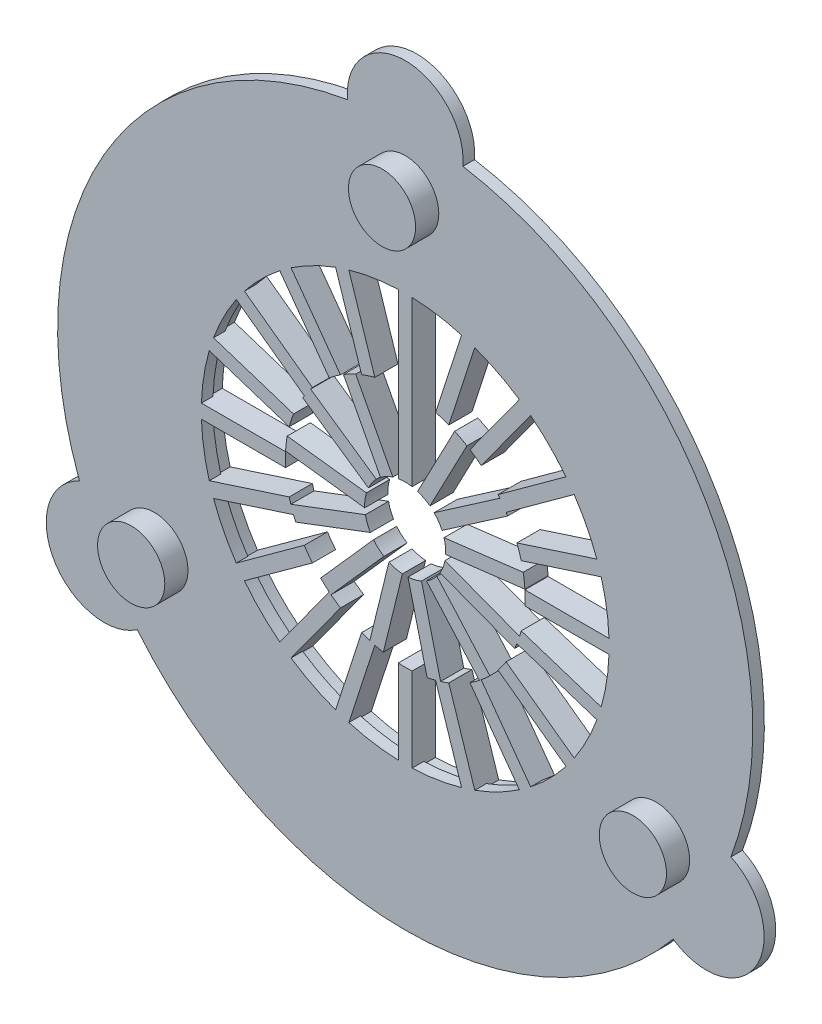
from build123d import *

# Parameters (mm, degrees)
SKETCH2_R           = 18.85
SKETCH2_R_2         = 17.804043165
BOSS_EXTRUDE1_DEPTH = 2
SKETCH3_R           = 30
SKETCH3_R_2         = 17.600030795
BOSS_EXTRUDE2_DEPTH = 1
SKETCH4_R           = 2.9
BOSS_EXTRUDE3_DEPTH = 2
SKETCH6_R           = 5
BOSS_EXTRUDE4_DEPTH = 1


with BuildPart() as part:
    # Sketch2 → Boss-Extrude1 (new body)
    # profile 1 of 34: a face of its own
    with BuildSketch(Plane.XY.offset(10)):
        Circle(SKETCH2_R)
        Circle(SKETCH2_R_2, mode=Mode.SUBTRACT)
    # profile 2 of 34: a face of its own
    with BuildSketch(Plane.XY.offset(10)):
        with BuildLine():
            ThreePointArc((14.748263104, 9.973599573), (14.403773489, 10.464954003), (14.042920801, 10.944419966))
            Line((14.042920801, 10.944419966), (8.004799589, 6.557468116))
            ThreePointArc((8.004799589, 6.557468116), (8.083447524, 6.460269397), (8.160915289, 6.36212749))
            ThreePointArc((8.160915289, 6.36212749), (8.444435139, 5.980695589), (8.710141891, 5.586647723))
            Line((8.710141891, 5.586647723), (14.748263104, 9.973599573))
        make_face()
    # profile 3 of 34: a face of its own
    with BuildSketch(Plane.XY.offset(10)):
        with BuildLine():
            ThreePointArc((10.944419966, 14.042920801), (10.464954003, 14.403773489), (9.973599573, 14.748263104))
            Line((9.973599573, 14.748263104), (5.586647723, 8.710141891))
            ThreePointArc((5.586647723, 8.710141891), (6.082291042, 8.371555425), (6.557468116, 8.004799589))
            Line((6.557468116, 8.004799589), (10.944419966, 14.042920801))
        make_face()
    # profile 4 of 34: a face of its own
    with BuildSketch(Plane.XY.offset(10)):
        with BuildLine():
            ThreePointArc((6.069260747, 16.737623099), (5.501751906, 16.932651268), (4.927992928, 17.108443492))
            Line((4.927992928, 17.108443492), (2.621635853, 10.010206292))
            ThreePointArc((2.621635853, 10.010206292), (3.197649634, 9.841353635), (3.762903673, 9.639385898))
            Line((3.762903673, 9.639385898), (6.069260747, 16.737623099))
        make_face()
    # profile 5 of 34: a face of its own
    with BuildSketch(Plane.XY.offset(10)):
        with BuildLine():
            ThreePointArc((0.6, 17.793930229), (0, 17.804043165), (-0.6, 17.793930229))
            Line((-0.6, 17.793930229), (-0.6, 10.330401955))
            ThreePointArc((-0.6, 10.330401955), (0, 10.347811582), (0.6, 10.330401955))
            Line((0.6, 10.330401955), (0.6, 17.793930229))
        make_face()
    # profile 6 of 34: a face of its own
    with BuildSketch(Plane.XY.offset(10)):
        with BuildLine():
            Line((-2.621635853, 10.010206292), (-4.927992928, 17.108443492))
            ThreePointArc((-4.927992928, 17.108443492), (-5.501751906, 16.932651268), (-6.069260747, 16.737623099))
            Line((-6.069260747, 16.737623099), (-3.762903673, 9.639385898))
            ThreePointArc((-3.762903673, 9.639385898), (-3.197649634, 9.841353635), (-2.621635853, 10.010206292))
        make_face()
    # profile 7 of 34: a face of its own
    with BuildSketch(Plane.XY.offset(10)):
        with BuildLine():
            Line((-5.586647723, 8.710141891), (-9.973599573, 14.748263104))
            ThreePointArc((-9.973599573, 14.748263104), (-10.464954003, 14.403773489), (-10.944419966, 14.042920801))
            Line((-10.944419966, 14.042920801), (-6.557468116, 8.004799589))
            ThreePointArc((-6.557468116, 8.004799589), (-6.082291042, 8.371555425), (-5.586647723, 8.710141891))
        make_face()
    # profile 8 of 34: a face of its own
    with BuildSketch(Plane.XY.offset(10)):
        with BuildLine():
            Line((-8.004799589, 6.557468116), (-14.042920801, 10.944419966))
            ThreePointArc((-14.042920801, 10.944419966), (-14.403773489, 10.464954003), (-14.748263104, 9.973599573))
            Line((-14.748263104, 9.973599573), (-8.710141891, 5.586647723))
            ThreePointArc((-8.710141891, 5.586647723), (-8.444435139, 5.980695589), (-8.160915289, 6.36212749))
            ThreePointArc((-8.160915289, 6.36212749), (-8.083447524, 6.460269397), (-8.004799589, 6.557468116))
        make_face()
    # profile 9 of 34: a face of its own
    with BuildSketch(Plane.XY.offset(10)):
        with BuildLine():
            Line((-9.639385898, 3.762903673), (-16.737623099, 6.069260747))
            ThreePointArc((-16.737623099, 6.069260747), (-16.932651268, 5.501751906), (-17.108443492, 4.927992928))
            Line((-17.108443492, 4.927992928), (-10.010206292, 2.621635853))
            ThreePointArc((-10.010206292, 2.621635853), (-9.841353635, 3.197649634), (-9.639385898, 3.762903673))
        make_face()
    # profile 10 of 34: a face of its own
    with BuildSketch(Plane.XY.offset(10)):
        with BuildLine():
            Line((-10.330401955, 0.6), (-17.793930229, 0.6))
            ThreePointArc((-17.793930229, 0.6), (-17.804043165, 0), (-17.793930229, -0.6))
            Line((-17.793930229, -0.6), (-10.330401955, -0.6))
            ThreePointArc((-10.330401955, -0.6), (-10.347811582, 0), (-10.330401955, 0.6))
        make_face()
    # profile 11 of 34: a face of its own
    with BuildSketch(Plane.XY.offset(10)):
        with BuildLine():
            ThreePointArc((-9.639385898, -3.762903673), (-9.761212907, -3.434519927), (-9.871856553, -3.102201273))
            ThreePointArc((-9.871856553, -3.102201273), (-9.943934911, -2.862754447), (-10.010206292, -2.621635853))
            Line((-10.010206292, -2.621635853), (-17.108443492, -4.927992928))
            ThreePointArc((-17.108443492, -4.927992928), (-16.932651268, -5.501751906), (-16.737623099, -6.069260747))
            Line((-16.737623099, -6.069260747), (-9.639385898, -3.762903673))
        make_face()
    # profile 12 of 34: a face of its own
    with BuildSketch(Plane.XY.offset(10)):
        with BuildLine():
            ThreePointArc((-8.004799589, -6.557468116), (-8.371555425, -6.082291042), (-8.710141891, -5.586647723))
            Line((-8.710141891, -5.586647723), (-14.748263104, -9.973599573))
            ThreePointArc((-14.748263104, -9.973599573), (-14.403773489, -10.464954003), (-14.042920801, -10.944419966))
            Line((-14.042920801, -10.944419966), (-8.004799589, -6.557468116))
        make_face()
    # profile 13 of 34: a face of its own
    with BuildSketch(Plane.XY.offset(10)):
        with BuildLine():
            ThreePointArc((-6.401217156, -8.130290491), (-6.47964644, -8.067923312), (-6.557468116, -8.004799589))
            Line((-6.557468116, -8.004799589), (-10.944419966, -14.042920801))
            ThreePointArc((-10.944419966, -14.042920801), (-10.464954003, -14.403773489), (-9.973599573, -14.748263104))
            Line((-9.973599573, -14.748263104), (-5.586647723, -8.710141891))
            ThreePointArc((-5.586647723, -8.710141891), (-6.000940176, -8.43006059), (-6.401217156, -8.130290491))
        make_face()
    # profile 14 of 34: a face of its own
    with BuildSketch(Plane.XY.offset(10)):
        with BuildLine():
            ThreePointArc((-2.621635853, -10.010206292), (-2.838886463, -9.950775256), (-3.054792097, -9.88662985))
            ThreePointArc((-3.054792097, -9.88662985), (-3.411088725, -9.769425687), (-3.762903673, -9.639385898))
            Line((-3.762903673, -9.639385898), (-6.069260747, -16.737623099))
            ThreePointArc((-6.069260747, -16.737623099), (-5.501751906, -16.932651268), (-4.927992928, -17.108443492))
            Line((-4.927992928, -17.108443492), (-2.621635853, -10.010206292))
        make_face()
    # profile 15 of 34: a face of its own
    with BuildSketch(Plane.XY.offset(10)):
        with BuildLine():
            ThreePointArc((0.6, -10.330401955), (0, -10.347811582), (-0.6, -10.330401955))
            Line((-0.6, -10.330401955), (-0.6, -17.793930229))
            ThreePointArc((-0.6, -17.793930229), (0, -17.804043165), (0.6, -17.793930229))
            Line((0.6, -17.793930229), (0.6, -10.330401955))
        make_face()
    # profile 16 of 34: a face of its own
    with BuildSketch(Plane.XY.offset(10)):
        with BuildLine():
            ThreePointArc((3.762903673, -9.639385898), (3.411088725, -9.769425687), (3.054792097, -9.88662985))
            ThreePointArc((3.054792097, -9.88662985), (2.838886463, -9.950775256), (2.621635853, -10.010206292))
            Line((2.621635853, -10.010206292), (4.927992928, -17.108443492))
            ThreePointArc((4.927992928, -17.108443492), (5.501751906, -16.932651268), (6.069260747, -16.737623099))
            Line((6.069260747, -16.737623099), (3.762903673, -9.639385898))
        make_face()
    # profile 17 of 34: a face of its own
    with BuildSketch(Plane.XY.offset(10)):
        with BuildLine():
            Line((10.944419966, -14.042920801), (6.557468116, -8.004799589))
            ThreePointArc((6.557468116, -8.004799589), (6.47964644, -8.067923312), (6.401217156, -8.130290491))
            ThreePointArc((6.401217156, -8.130290491), (6.000940176, -8.43006059), (5.586647723, -8.710141891))
            Line((5.586647723, -8.710141891), (9.973599573, -14.748263104))
            ThreePointArc((9.973599573, -14.748263104), (10.464954003, -14.403773489), (10.944419966, -14.042920801))
        make_face()
    # profile 18 of 34: a face of its own
    with BuildSketch(Plane.XY.offset(10)):
        with BuildLine():
            ThreePointArc((17.108443492, 4.927992928), (16.932651268, 5.501751906), (16.737623099, 6.069260747))
            Line((16.737623099, 6.069260747), (9.639385898, 3.762903673))
            ThreePointArc((9.639385898, 3.762903673), (9.841353635, 3.197649634), (10.010206292, 2.621635853))
            Line((10.010206292, 2.621635853), (17.108443492, 4.927992928))
        make_face()
    # profile 19 of 34: a face of its own
    with BuildSketch(Plane.XY.offset(10)):
        with BuildLine():
            ThreePointArc((17.804043165, 0), (17.801514751, 0.30004261), (17.793930229, 0.6))
            Line((17.793930229, 0.6), (10.330401955, 0.6))
            ThreePointArc((10.330401955, 0.6), (10.34345826, 0.300126263), (10.347811582, 0))
            ThreePointArc((10.347811582, 0), (10.34345826, -0.300126263), (10.330401955, -0.6))
            Line((10.330401955, -0.6), (17.793930229, -0.6))
            ThreePointArc((17.793930229, -0.6), (17.801514751, -0.30004261), (17.804043165, 0))
        make_face()
    # profile 20 of 34: a face of its own
    with BuildSketch(Plane.XY.offset(10)):
        with BuildLine():
            ThreePointArc((10.010206292, -2.621635853), (9.943934911, -2.862754447), (9.871856553, -3.102201273))
            ThreePointArc((9.871856553, -3.102201273), (9.761212907, -3.434519927), (9.639385898, -3.762903673))
            Line((9.639385898, -3.762903673), (16.737623099, -6.069260747))
            ThreePointArc((16.737623099, -6.069260747), (16.932651268, -5.501751906), (17.108443492, -4.927992928))
            Line((17.108443492, -4.927992928), (10.010206292, -2.621635853))
        make_face()
    # profile 21 of 34: a face of its own
    with BuildSketch(Plane.XY.offset(10)):
        with BuildLine():
            Line((14.748263104, -9.973599573), (8.710141891, -5.586647723))
            ThreePointArc((8.710141891, -5.586647723), (8.371555425, -6.082291042), (8.004799589, -6.557468116))
            Line((8.004799589, -6.557468116), (14.042920801, -10.944419966))
            ThreePointArc((14.042920801, -10.944419966), (14.403773489, -10.464954003), (14.748263104, -9.973599573))
        make_face()
    # profile 22 of 34: a face of its own
    with BuildSketch(Plane.XY.offset(10)):
        with BuildLine():
            ThreePointArc((0.6, 10.330401955), (0, 10.347811582), (-0.6, 10.330401955))
            Line((-0.6, 10.330401955), (-0.6, 3.446994379))
            ThreePointArc((-0.6, 3.446994379), (0, 3.498824124), (0.6, 3.446994379))
            Line((0.6, 3.446994379), (0.6, 10.330401955))
        make_face()
    # profile 23 of 34: a face of its own
    with BuildSketch(Plane.XY.offset(10)):
        with BuildLine():
            ThreePointArc((-2.133171777, 2.77332804), (-1.625984645, 3.098054903), (-1.070624546, 3.330995847))
            Line((-1.070624546, 3.330995847), (-4.269503549, 9.425950561))
            ThreePointArc((-4.269503549, 9.425950561), (-4.808867822, 9.162532118), (-5.33205078, 8.868282755))
            Line((-5.33205078, 8.868282755), (-2.133171777, 2.77332804))
        make_face()
    # profile 24 of 34: a face of its own
    with BuildSketch(Plane.XY.offset(10)):
        with BuildLine():
            ThreePointArc((-3.177659608, 1.464325669), (-2.879475803, 1.98755864), (-2.495981912, 2.451906308))
            Line((-2.495981912, 2.451906308), (-8.160915289, 6.36212749))
            ThreePointArc((-8.160915289, 6.36212749), (-8.444435139, 5.980695589), (-8.710141891, 5.586647723))
            ThreePointArc((-8.710141891, 5.586647723), (-8.777008152, 5.480997395), (-8.842592985, 5.374546851))
            Line((-8.842592985, 5.374546851), (-3.177659608, 1.464325669))
        make_face()
    # profile 25 of 34: a face of its own
    with BuildSketch(Plane.XY.offset(10)):
        with BuildLine():
            ThreePointArc((-3.494183917, -0.180136065), (-3.473313757, 0.421736645), (-3.349539901, 1.011114584))
            Line((-3.349539901, 1.011114584), (-10.182759685, 1.840817682))
            ThreePointArc((-10.182759685, 1.840817682), (-10.272364385, 1.247290856), (-10.327403702, 0.649567033))
            Line((-10.327403702, 0.649567033), (-3.494183917, -0.180136065))
        make_face()
    # profile 26 of 34: a face of its own
    with BuildSketch(Plane.XY.offset(10)):
        with BuildLine():
            ThreePointArc((-3.010232801, -1.783330798), (-3.271457386, -1.240700133), (-3.435758665, -0.661311307))
            Line((-3.435758665, -0.661311307), (-9.871856553, -3.102201273))
            ThreePointArc((-9.871856553, -3.102201273), (-9.761212907, -3.434519927), (-9.639385898, -3.762903673))
            ThreePointArc((-9.639385898, -3.762903673), (-9.545645488, -3.994728623), (-9.446330689, -4.224220764))
            Line((-9.446330689, -4.224220764), (-3.010232801, -1.783330798))
        make_face()
    # profile 27 of 34: a face of its own
    with BuildSketch(Plane.XY.offset(10)):
        with BuildLine():
            ThreePointArc((-1.836673627, -2.977985937), (-2.320149554, -2.618907463), (-2.734886524, -2.182238747))
            Line((-2.734886524, -2.182238747), (-7.299430054, -7.334543301))
            ThreePointArc((-7.299430054, -7.334543301), (-6.936549401, -7.678638353), (-6.557468116, -8.004799589))
            ThreePointArc((-6.557468116, -8.004799589), (-6.47964644, -8.067923312), (-6.401217156, -8.130290491))
            Line((-6.401217156, -8.130290491), (-1.836673627, -2.977985937))
        make_face()
    # profile 28 of 34: a face of its own
    with BuildSketch(Plane.XY.offset(10)):
        with BuildLine():
            ThreePointArc((-0.242354659, -3.490420386), (-0.837323419, -3.397154654), (-1.40748484, -3.203241588))
            Line((-1.40748484, -3.203241588), (-3.054792097, -9.88662985))
            ThreePointArc((-3.054792097, -9.88662985), (-2.838886463, -9.950775256), (-2.621635853, -10.010206292))
            ThreePointArc((-2.621635853, -10.010206292), (-2.257131658, -10.098641553), (-1.889661916, -10.173808647))
            Line((-1.889661916, -10.173808647), (-0.242354659, -3.490420386))
        make_face()
    # profile 29 of 34: a face of its own
    with BuildSketch(Plane.XY.offset(10)):
        with BuildLine():
            Line((3.054792097, -9.88662985), (1.40748484, -3.203241588))
            ThreePointArc((1.40748484, -3.203241588), (0.837323419, -3.397154654), (0.242354659, -3.490420386))
            Line((0.242354659, -3.490420386), (1.889661916, -10.173808647))
            ThreePointArc((1.889661916, -10.173808647), (2.257131658, -10.098641553), (2.621635853, -10.010206292))
            ThreePointArc((2.621635853, -10.010206292), (2.838886463, -9.950775256), (3.054792097, -9.88662985))
        make_face()
    # profile 30 of 34: a face of its own
    with BuildSketch(Plane.XY.offset(10)):
        with BuildLine():
            Line((7.299430054, -7.334543301), (2.734886524, -2.182238747))
            ThreePointArc((2.734886524, -2.182238747), (2.320149554, -2.618907463), (1.836673627, -2.977985937))
            Line((1.836673627, -2.977985937), (6.401217156, -8.130290491))
            ThreePointArc((6.401217156, -8.130290491), (6.47964644, -8.067923312), (6.557468116, -8.004799589))
            ThreePointArc((6.557468116, -8.004799589), (6.936549401, -7.678638353), (7.299430054, -7.334543301))
        make_face()
    # profile 31 of 34: a face of its own
    with BuildSketch(Plane.XY.offset(10)):
        with BuildLine():
            Line((9.871856553, -3.102201273), (3.435758665, -0.661311307))
            ThreePointArc((3.435758665, -0.661311307), (3.271457386, -1.240700133), (3.010232801, -1.783330798))
            Line((3.010232801, -1.783330798), (9.446330689, -4.224220764))
            ThreePointArc((9.446330689, -4.224220764), (9.545645488, -3.994728623), (9.639385898, -3.762903673))
            ThreePointArc((9.639385898, -3.762903673), (9.761212907, -3.434519927), (9.871856553, -3.102201273))
        make_face()
    # profile 32 of 34: a face of its own
    with BuildSketch(Plane.XY.offset(10)):
        with BuildLine():
            Line((10.182759685, 1.840817682), (3.349539901, 1.011114584))
            ThreePointArc((3.349539901, 1.011114584), (3.461301869, 0.511037787), (3.498824124, 0))
            ThreePointArc((3.498824124, 0), (3.49766388, -0.09009791), (3.494183917, -0.180136065))
            Line((3.494183917, -0.180136065), (10.327403702, 0.649567033))
            ThreePointArc((10.327403702, 0.649567033), (10.272364385, 1.247290856), (10.182759685, 1.840817682))
        make_face()
    # profile 33 of 34: a face of its own
    with BuildSketch(Plane.XY.offset(10)):
        with BuildLine():
            Line((8.160915289, 6.36212749), (2.495981912, 2.451906308))
            ThreePointArc((2.495981912, 2.451906308), (2.879475803, 1.98755864), (3.177659608, 1.464325669))
            Line((3.177659608, 1.464325669), (8.842592985, 5.374546851))
            ThreePointArc((8.842592985, 5.374546851), (8.777008152, 5.480997395), (8.710141891, 5.586647723))
            ThreePointArc((8.710141891, 5.586647723), (8.444435139, 5.980695589), (8.160915289, 6.36212749))
        make_face()
    # profile 34 of 34: a face of its own
    with BuildSketch(Plane.XY.offset(10)):
        with BuildLine():
            Line((4.269503549, 9.425950561), (1.070624546, 3.330995847))
            ThreePointArc((1.070624546, 3.330995847), (1.625984645, 3.098054903), (2.133171777, 2.77332804))
            Line((2.133171777, 2.77332804), (5.33205078, 8.868282755))
            ThreePointArc((5.33205078, 8.868282755), (4.808867822, 9.162532118), (4.269503549, 9.425950561))
        make_face()
    extrude(amount=BOSS_EXTRUDE1_DEPTH)

    # Sketch3 → Boss-Extrude2 (add)
    with BuildSketch(Plane.XY.offset(12)):
        Circle(SKETCH3_R)
        Circle(SKETCH3_R_2, mode=Mode.SUBTRACT)
    extrude(amount=-BOSS_EXTRUDE2_DEPTH)

    # Sketch4 → Boss-Extrude3 (add)
    with BuildSketch(Plane.XY.offset(12)):
        with Locations((0, 25)):
            Circle(SKETCH4_R)
        with Locations((21.650635095, -12.5)):
            Circle(SKETCH4_R)
        with Locations((-21.650635095, -12.5)):
            Circle(SKETCH4_R)
    extrude(amount=BOSS_EXTRUDE3_DEPTH)

    # Sketch6 → Boss-Extrude4 (add)
    with BuildSketch(Plane(origin=(0, 0, 11), x_dir=(-1, 0, 0), z_dir=(0, 0, -1))):
        with Locations((0, 30)):
            Circle(SKETCH6_R)
        with Locations((25.980762114, -15)):
            Circle(SKETCH6_R)
        with Locations((-25.980762114, -15)):
            Circle(SKETCH6_R)
    extrude(amount=-BOSS_EXTRUDE4_DEPTH)


solid = part.part
